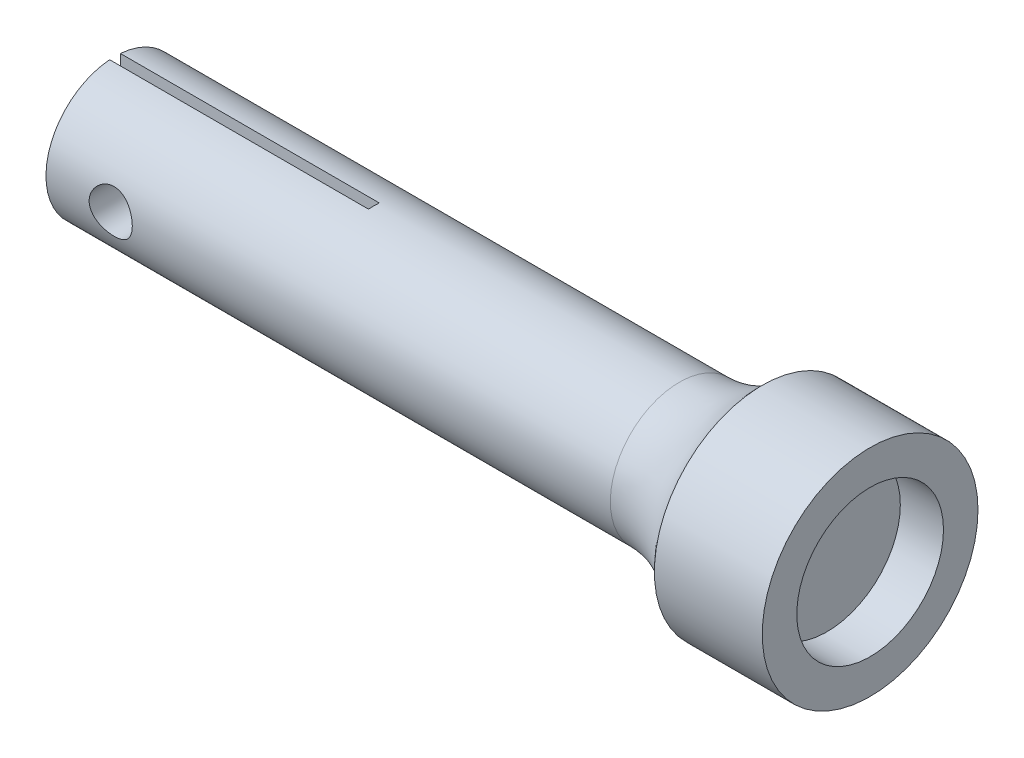
from build123d import *

# Parameters (mm, degrees)
SKETCH_1_R               = 3.2
EXTRUDE_1_DEPTH          = 30
SKETCH_2_W               = 0.5
SKETCH_2_H               = 6.454336116
CUT_EXTRUDE_1_DEPTH      = 12
CUT_EXTRUDE_2_DEPTH      = 10
CUT_EXTRUDE_2_DEPTH_BACK = 10
SKETCH_3_R               = 1
SKETCH_6_R               = 5
EXTRUDE_2_DEPTH          = 5
FILLET_1_R               = 5
SKETCH_7_R               = 3.4
CUT_EXTRUDE_3_DEPTH      = 2


with BuildPart() as part:
    # 草图1 → 凸台-拉伸1 (new body)
    with BuildSketch(Plane(origin=(0, 0, 0), x_dir=(0, 0, -1), z_dir=(1, 0, 0))):
        Circle(SKETCH_1_R)
    extrude(amount=EXTRUDE_1_DEPTH)

    # 草图2 → 切除-拉伸1 (cut)
    with BuildSketch(Plane.ZY):
        with Locations((0, 0.634798729)):
            Rectangle(SKETCH_2_W, SKETCH_2_H)
    extrude(amount=-CUT_EXTRUDE_1_DEPTH, mode=Mode.SUBTRACT)

    # 草图3 → 切除-拉伸2 (cut, two sides: drawn at the far end of the back side and taken through both)
    with BuildSketch(Plane(origin=(0, 0, 0.25), x_dir=(-1, 0, 0), z_dir=(0, 0, -1)).offset(-CUT_EXTRUDE_2_DEPTH_BACK)):
        with Locations(Location((-3, -0.004890286, 0), (0, 0, 180))):
            Circle(SKETCH_3_R)
    extrude(amount=CUT_EXTRUDE_2_DEPTH + CUT_EXTRUDE_2_DEPTH_BACK, mode=Mode.SUBTRACT)

    # 草图6 → 凸台-拉伸2 (add)
    with BuildSketch(Plane(origin=(30, 0, 0), x_dir=(0, 0, -1), z_dir=(1, 0, 0))):
        Circle(SKETCH_6_R)
    extrude(amount=EXTRUDE_2_DEPTH)

    # 圆角1
    # the kernel refuses this fillet: 5 mm, written as the material it adds along each edge
    with BuildSketch(Plane(origin=(30, 0, 0), x_dir=(0, 0, -1), z_dir=(0, -1, 0))) as fillet_1_piece_1:
        with BuildLine():
            CenterArc((8.2, -3.841874542), FILLET_1_R, 129.7918195, 50.2081805)
            Line((3.2, -3.841874542), (3.1, -3.841874542))
            Line((3.1, -3.841874542), (3.1, 0))
            Line((3.1, 0), (3.2, 0.1))
            ThreePointArc((3.2, 0.1), (4.1, 0.1), (4.936, 0.076837491))
            Line((4.936, 0.076837491), (5, 0))
        make_face()
    revolve(axis=Axis((30, 0, 0), (1, 0, 0)))

    # 草图7 → 切除-拉伸3 (cut)
    with BuildSketch(Plane(origin=(35, 0, 0), x_dir=(0, 0, -1), z_dir=(1, 0, 0))):
        Circle(SKETCH_7_R)
    extrude(amount=-CUT_EXTRUDE_3_DEPTH, mode=Mode.SUBTRACT)


solid = part.part
